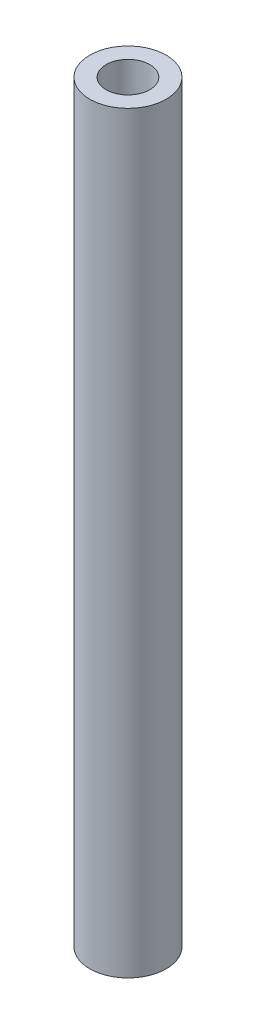
from build123d import *

# Parameters (mm, degrees)
ESBO_O1_W = 1.5
ESBO_O1_H = 69


with BuildPart() as part:
    # Esboço1 → Revolução1 (revolve)
    with BuildSketch(Plane(origin=(0, 0, 0), x_dir=(-1, 0, 0), z_dir=(0, 0, -1))):
        with Locations((53.96460554, -34.5)):
            Rectangle(ESBO_O1_W, ESBO_O1_H)
    revolve(axis=Axis((-56.71460554, -69, 0), (0, 1, 0)))


solid = part.part
